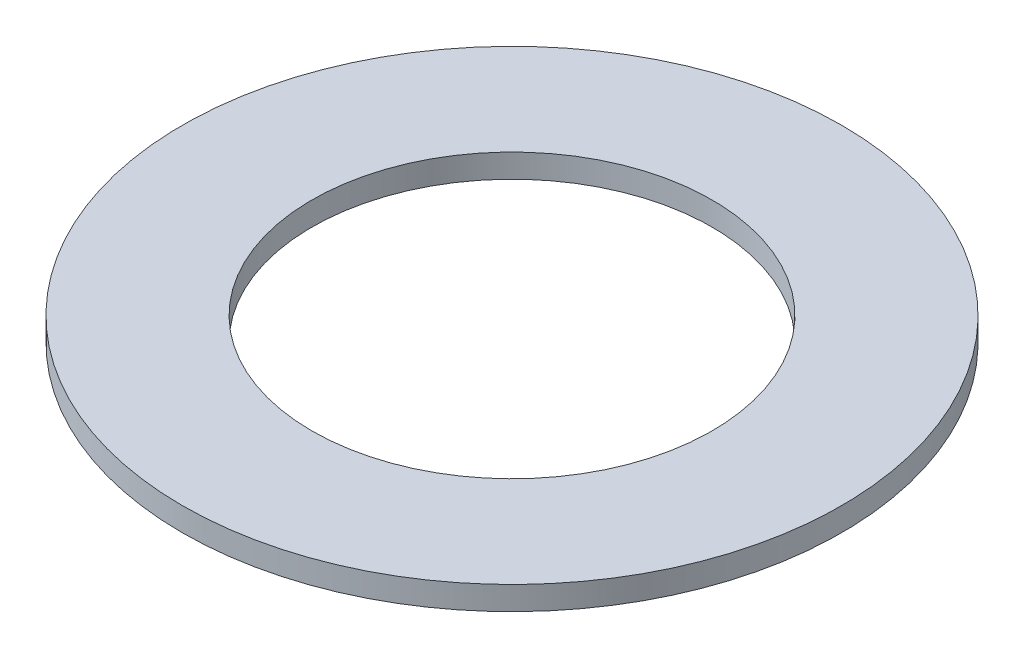
from build123d import *

# Parameters (mm, degrees)
SKETCH1_R           = 70
BOSS_EXTRUDE1_DEPTH = 5
SKETCH2_R           = 42.5
CUT_EXTRUDE1_DEPTH  = 100.121138008


with BuildPart() as part:
    # Sketch1 → Boss-Extrude1 (new body)
    with BuildSketch(Plane(origin=(0, 0, 0), x_dir=(1, 0, 0), z_dir=(0, 1, 0))):
        Circle(SKETCH1_R)
    extrude(amount=BOSS_EXTRUDE1_DEPTH)

    # Sketch2 → Cut-Extrude1 (cut, through all)
    with BuildSketch(Plane(origin=(0, 0, 0), x_dir=(1, 0, 0), z_dir=(0, 1, 0))):
        Circle(SKETCH2_R)
    extrude(amount=CUT_EXTRUDE1_DEPTH, mode=Mode.SUBTRACT)


solid = part.part
